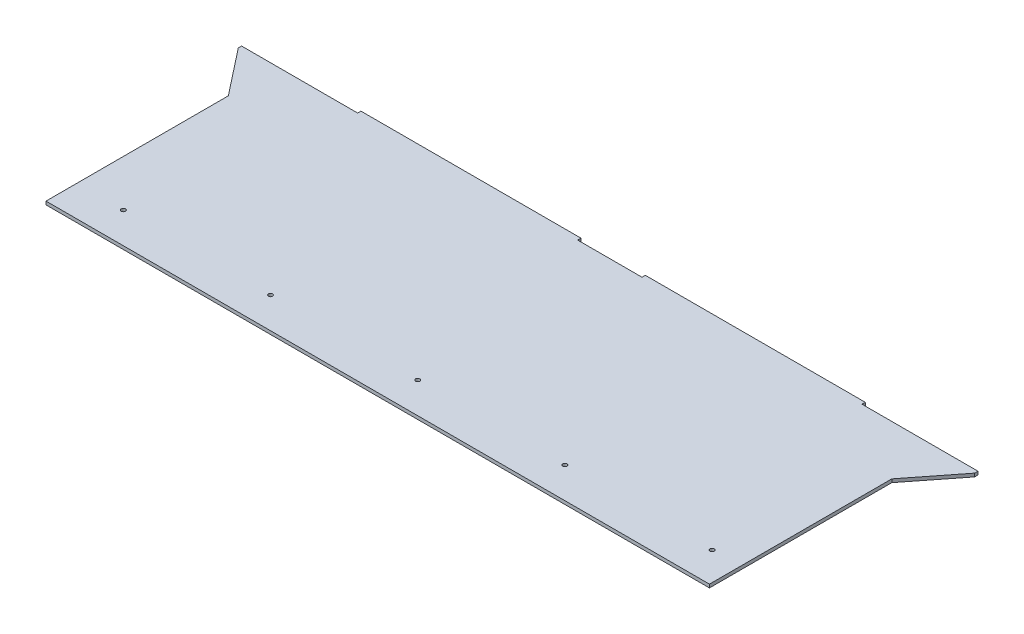
from build123d import *

# Parameters (mm, degrees)
SKETCH1_W           = 635.3556
SKETCH1_H           = 222.25
BOSS_EXTRUDE1_DEPTH = 1.5875
SKETCH2_W           = 210.6549
SKETCH2_H           = 3.175
BOSS_EXTRUDE2_DEPTH = 3.175
BOSS_EXTRUDE3_DEPTH = 3.175
SKETCH4_R           = 2.025
CUT_EXTRUDE1_DEPTH  = 10
LPATTERN1_COUNT     = 5
LPATTERN1_PITCH     = 140.97


with BuildPart() as part:
    # Sketch1 → Boss-Extrude1 (new, symmetric)
    with BuildSketch(Plane(origin=(0, 0, 0), x_dir=(1, 0, 0), z_dir=(0, 1, 0))):
        Rectangle(SKETCH1_W, SKETCH1_H)
    extrude(amount=BOSS_EXTRUDE1_DEPTH, both=True)

    # Sketch2 → Boss-Extrude2 (add)
    with BuildSketch(Plane(origin=(0, 0, -111.125), x_dir=(-1, 0, 0), z_dir=(0, 0, -1))):
        with Locations((136.15035, 0)):
            Rectangle(SKETCH2_W, SKETCH2_H)
        with Locations((-136.15035, 0)):
            Rectangle(SKETCH2_W, SKETCH2_H)
    extrude(amount=BOSS_EXTRUDE2_DEPTH)

    # Sketch3 → Boss-Extrude3 (add)
    with BuildSketch(Plane(origin=(0, 1.5875, 0), x_dir=(1, 0, 0), z_dir=(0, 1, 0))):
        Polygon((-317.6778, 63.5), (-317.6778, 111.125), (-352.6028, 111.125), (-352.6028, 107.95), align=None)
    boss_extrude3 = extrude(amount=-BOSS_EXTRUDE3_DEPTH)

    # Mirror1: Boss-Extrude3 across plane
    add(boss_extrude3.mirror(Plane(origin=(0, 0, 0), x_dir=(0, 0, 1), z_dir=(1, 0, 0))))

    # Sketch4 → Cut-Extrude1 (cut)
    with BuildSketch(Plane(origin=(0, 1.5875, 0), x_dir=(1, 0, 0), z_dir=(0, 1, 0))):
        with Locations((-273.2278, -81.534)):
            Circle(SKETCH4_R)
    cut_extrude1 = extrude(amount=-CUT_EXTRUDE1_DEPTH, mode=Mode.SUBTRACT)

    # LPattern1: Cut-Extrude1 ×5
    with Locations(*[(i * LPATTERN1_PITCH, 0, 0) for i in range(1, LPATTERN1_COUNT)]):
        add(cut_extrude1, mode=Mode.SUBTRACT)


solid = part.part
